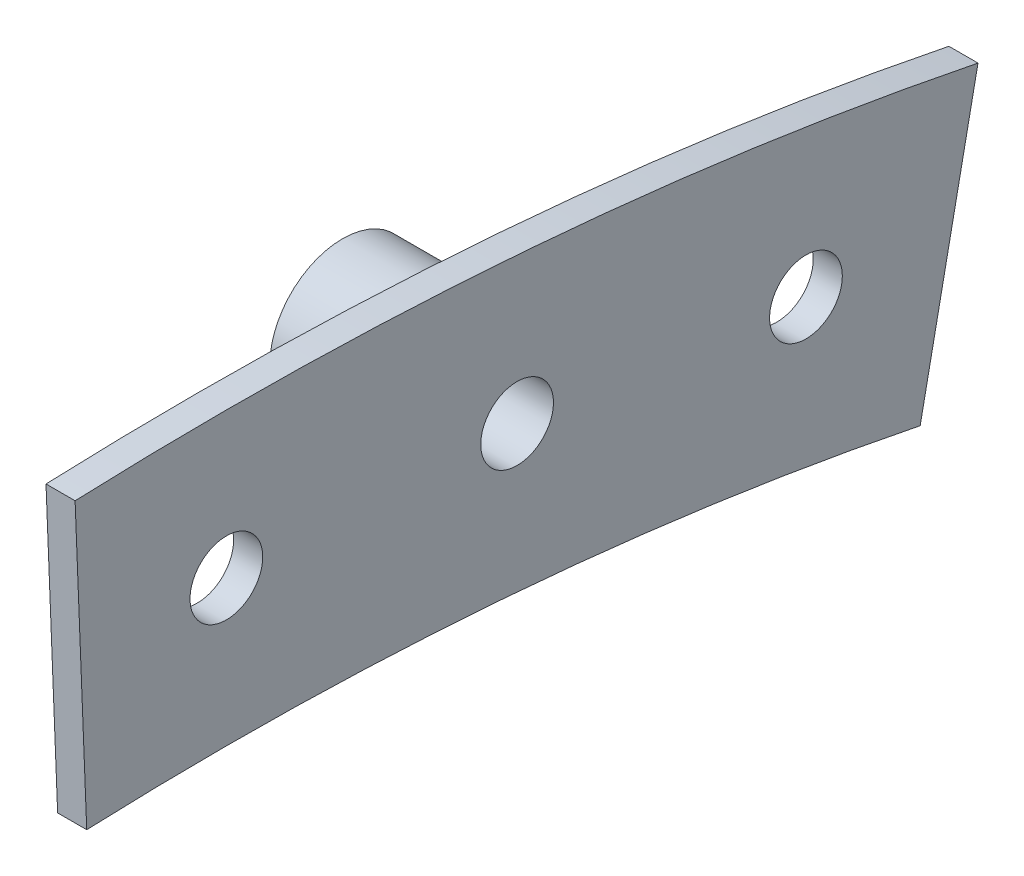
from build123d import *

# Parameters (mm, degrees)
BOSS_EXTRUDE1_DEPTH = 2.54
SKETCH2_R           = 6.35
BOSS_EXTRUDE2_DEPTH = 12.7
CUT_EXTRUDE1_START  = -6.35
SKETCH4_R           = 3.175
CUT_EXTRUDE1_DEPTH  = 6.35


with BuildPart() as part:
    # Sketch1 → Boss-Extrude1 (new body)
    with BuildSketch(Plane(origin=(0, 0, 0), x_dir=(0, 0, -1), z_dir=(1, 0, 0))):
        with BuildLine():
            Line((-13.205358136, 329.93584), (-12.189561356, 304.55616))
            ThreePointArc((-12.189561356, 304.55616), (24.364484991, 303.82464), (60.567963461, 298.721545594))
            Line((60.567963461, 298.721545594), (65.615293749, 323.615007727))
            ThreePointArc((65.615293749, 323.615007727), (26.39485874, 329.14336), (-13.205358136, 329.93584))
        make_face()
        with BuildLine():
            ThreePointArc((53.771913831, 313.4425024), (50.35103003, 310.277037796), (47.459998142, 313.932793089))
            ThreePointArc((47.459998142, 313.932793089), (50.842797632, 316.607967004), (53.771913831, 313.4425024))
        make_face(mode=Mode.SUBTRACT)
        with BuildLine():
            ThreePointArc((3.175, 317.5), (3.174990078, 317.492062475), (3.174960312, 317.484125))
            ThreePointArc((3.174960312, 317.484125), (-3.174990078, 317.507937525), (3.175, 317.5))
        make_face(mode=Mode.SUBTRACT)
        with BuildLine():
            ThreePointArc((28.543203321, 316.214382254), (25.125875147, 313.31916), (22.213602443, 316.721969346))
            ThreePointArc((22.213602443, 316.721969346), (25.498740296, 319.65676657), (28.554671865, 316.484))
            ThreePointArc((28.554671865, 316.484), (28.551803434, 316.349069225), (28.543203321, 316.214382254))
        make_face(mode=Mode.SUBTRACT)
    extrude(amount=BOSS_EXTRUDE1_DEPTH)

    # Sketch2 → Boss-Extrude2 (add)
    with BuildSketch(Plane.ZY):
        with Locations((-25.379671865, 316.484)):
            Circle(SKETCH2_R)
    extrude(amount=BOSS_EXTRUDE2_DEPTH)

    # Sketch4 → Cut-Extrude1 (cut)
    with BuildSketch(Plane(origin=(0, 0, 0), x_dir=(0, 0, -1), z_dir=(1, 0, 0)).offset(CUT_EXTRUDE1_START)):
        with Locations((25.379671865, 316.484)):
            Circle(SKETCH4_R)
    extrude(amount=CUT_EXTRUDE1_DEPTH, mode=Mode.SUBTRACT)


solid = part.part
